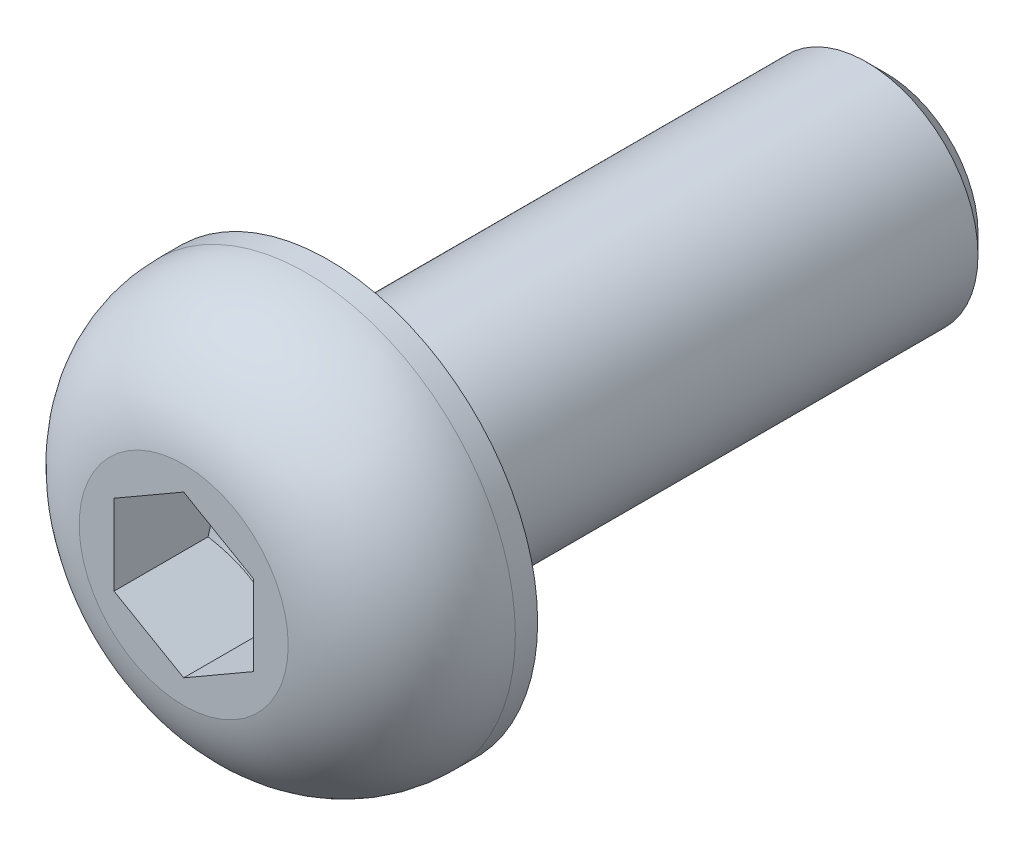
from build123d import *

# Parameters (mm, degrees)
CHAMFER1_SIZE      = 0.35
CUT_EXTRUDE1_START = -1.8000001
CUT_EXTRUDE1_DEPTH = 2.8000001
FILLET1_R          = 0.2


with BuildPart() as part:
    # Sketch1 → Revolve1 (revolve)
    with BuildSketch(Plane(origin=(0, 0, 0), x_dir=(0, 0, -1), z_dir=(1, 0, 0)), mode=Mode.PRIVATE) as revolve1_sk:
        with BuildLine():
            Line((10, 0), (10, 2))
            Line((10, 2), (0, 2))
            Line((0, 2), (0, 3.75))
            Line((0, 3.75), (-0.4, 3.75))
            ThreePointArc((-0.4, 3.75), (-1.845304899, 3.217657748), (-2.6, 1.875))
            Line((-2.6, 1.875), (-2.6, 0))
            Line((-2.6, 0), (10, 0))
        make_face()
    revolve(revolve1_sk.sketch.rotate(Axis((0, 0, 30.809969789), (0, 0, -1)), 90), axis=Axis((0, 0, 30.809969789), (0, 0, -1)))

    # Chamfer1
    chamfer1_edges = [part.edges().sort_by_distance(p)[0] for p in [
        (-2, 0, -10),
    ]]
    chamfer(chamfer1_edges, length=CHAMFER1_SIZE)

    # Sketch2 → Cut-Revolve1 (revolve, cut)
    with BuildSketch(Plane(origin=(0, 0, 0), x_dir=(0, 0, -1), z_dir=(1, 0, 0)), mode=Mode.PRIVATE) as cut_revolve1_sk:
        Polygon((-2.6, 0), (-2.6, 1.25), (-0.8, 1.25), (-0.078312164, 0), align=None)
    revolve(cut_revolve1_sk.sketch.rotate(Axis((0, 0, 2.452500839), (0, 0, -1)), 90), axis=Axis((0, 0, 2.452500839), (0, 0, -1)), mode=Mode.SUBTRACT)

    # Cut-Extrude1: read off the stored shape, not the designer's step
    # Cut-Extrude1 outline → Cut-Extrude1 (cut)
    with BuildSketch(Plane.XY.offset(2.6).offset(CUT_EXTRUDE1_START)):
        with BuildLine():
            Line((1.25, 0), (1.25, 0.721687836))
            Line((1.25, 0.721687836), (0.625, 1.082531755))
            ThreePointArc((0.625, 1.082531755), (1.082531755, 0.625), (1.25, 0))
        make_face()
        with BuildLine():
            ThreePointArc((-0.625, 1.082531755), (0, 1.25), (0.625, 1.082531755))
            Line((0.625, 1.082531755), (0, 1.443375673))
            Line((0, 1.443375673), (-0.625, 1.082531755))
        make_face()
        with BuildLine():
            Line((1.25, -0.721687836), (1.25, 0))
            ThreePointArc((1.25, 0), (1.082531755, -0.625), (0.625, -1.082531755))
            Line((0.625, -1.082531755), (1.25, -0.721687836))
        make_face()
        with BuildLine():
            ThreePointArc((-1.25, 0), (-1.082531755, 0.625), (-0.625, 1.082531755))
            Line((-0.625, 1.082531755), (-1.25, 0.721687836))
            Line((-1.25, 0.721687836), (-1.25, 0))
        make_face()
        with BuildLine():
            Line((0, -1.443375673), (0.625, -1.082531755))
            ThreePointArc((0.625, -1.082531755), (0, -1.25), (-0.625, -1.082531755))
            Line((-0.625, -1.082531755), (0, -1.443375673))
        make_face()
        with BuildLine():
            ThreePointArc((-0.625, -1.082531755), (-1.082531755, -0.625), (-1.25, 0))
            Line((-1.25, 0), (-1.25, -0.721687836))
            Line((-1.25, -0.721687836), (-0.625, -1.082531755))
        make_face()
    extrude(amount=CUT_EXTRUDE1_DEPTH, mode=Mode.SUBTRACT)

    # Cut-Extrude1 2 outline → Cut-Extrude1 2 (revolve)
    with BuildSketch(Plane.XZ):
        Polygon((1.443375738, 0.911645534), (1.249999957, 0.799999975), (1.443375673, 0.7999999), align=None)
    revolve(axis=Axis((0, 0, 0), (0, 0, 1)))

    # Fillet1
    fillet1_edges = [part.edges().sort_by_distance(p)[0] for p in [
        (-2, 0, 0),
    ]]
    fillet(fillet1_edges, radius=FILLET1_R)


solid = part.part
